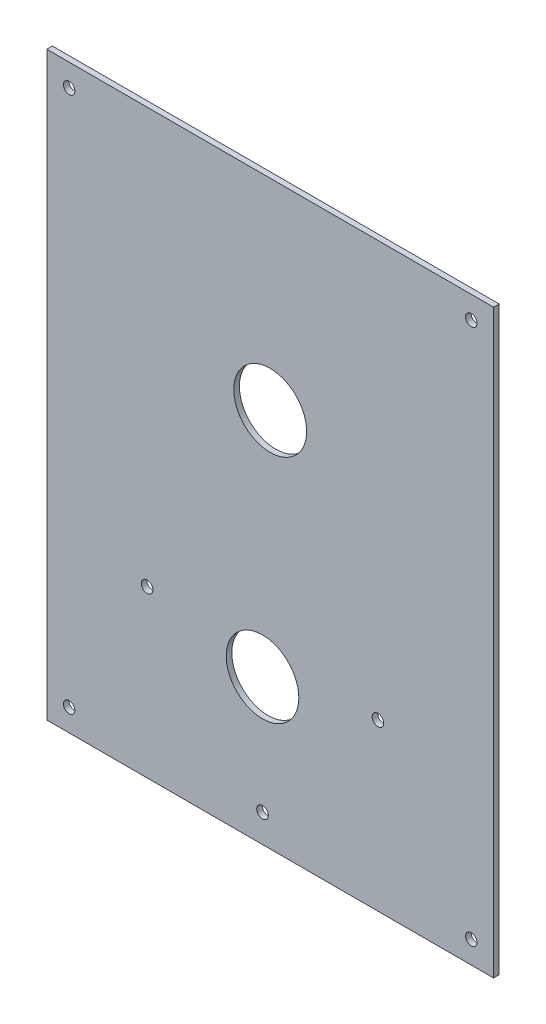
from build123d import *

# Parameters (mm, degrees)
SKETCH1_W           = 254
SKETCH1_H           = 330.2
SKETCH1_R           = 20.701
BOSS_EXTRUDE1_DEPTH = 3.175
SKETCH3_R           = 3.3
SKETCH3_R_2         = 20.6375
SKETCH3_R_3         = 3.2512
CUT_EXTRUDE2_DEPTH  = 258.174052555


with BuildPart() as part:
    # Sketch1 → Boss-Extrude1 (new body)
    with BuildSketch(Plane.XY):
        with Locations((19.981406387, -45.90919141)):
            Rectangle(SKETCH1_W, SKETCH1_H)
        with Locations((19.981406387, 4.89080859)):
            Circle(SKETCH1_R, mode=Mode.SUBTRACT)
    extrude(amount=-BOSS_EXTRUDE1_DEPTH)

    # Sketch3 → Cut-Extrude2 (cut, through all)
    with BuildSketch(Plane.XY):
        with Locations((-50.007395692, -116.889881573)):
            Circle(SKETCH3_R)
        with Locations((81.218237397, -116.889881573)):
            Circle(SKETCH3_R)
        with Locations((15.605420852, -195.08419141)):
            Circle(SKETCH3_R)
        with Locations((15.605420852, -128.45919141)):
            Circle(SKETCH3_R_2)
        with Locations((134.281406387, 106.49080859)):
            Circle(SKETCH3_R_3)
        with Locations((-94.318593613, 106.49080859)):
            Circle(SKETCH3_R_3)
        with Locations((134.281406387, -198.30919141)):
            Circle(SKETCH3_R_3)
        with Locations((-94.318593613, -198.30919141)):
            Circle(SKETCH3_R_3)
    extrude(amount=-CUT_EXTRUDE2_DEPTH, mode=Mode.SUBTRACT)


solid = part.part
